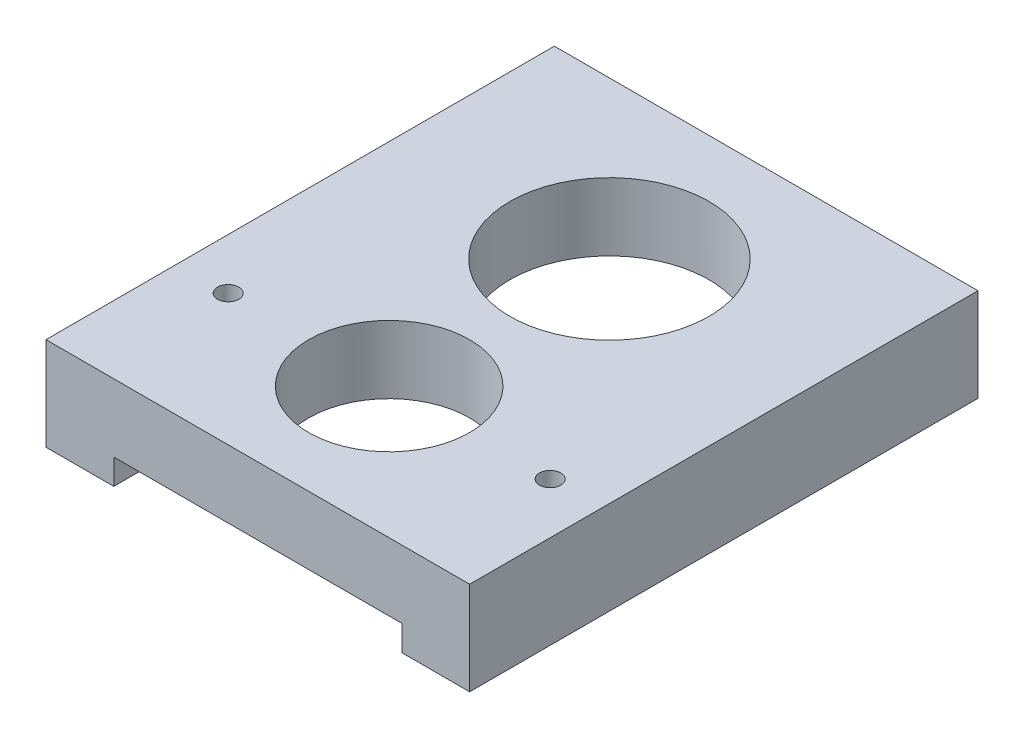
from build123d import *

# Parameters (mm, degrees)
EXTRUDE_1_DEPTH     = 60
SKETCH_2_R          = 11.75
CUT_EXTRUDE_1_DEPTH = 40
SKETCH_3_R          = 9.5
CUT_EXTRUDE_2_DEPTH = 40
M3X0_5_1_D          = 2.5
M3X0_5_1_DEPTH      = 5
M3X0_5_1_TIP        = 0.751075774


with BuildPart() as part:
    # 草圖1 → 填料-伸長1 (new body)
    with BuildSketch(Plane.XY):
        Polygon((-25, 0), (-17, 0), (-17, 3), (17, 3), (17, 0), (25, 0), (25, 11), (-25, 11), align=None)
    extrude(amount=EXTRUDE_1_DEPTH)

    # 草圖2 → 除料-伸長1 (cut)
    with BuildSketch(Plane(origin=(0, 11, 0), x_dir=(1, 0, 0), z_dir=(0, 1, 0))):
        with Locations((0, -18.5)):
            Circle(SKETCH_2_R)
    extrude(amount=-CUT_EXTRUDE_1_DEPTH, mode=Mode.SUBTRACT)

    # 草圖3 → 除料-伸長2 (cut)
    with BuildSketch(Plane(origin=(0, 11, 0), x_dir=(1, 0, 0), z_dir=(0, 1, 0))):
        with Locations((0, -44.5)):
            Circle(SKETCH_3_R)
    extrude(amount=-CUT_EXTRUDE_2_DEPTH, mode=Mode.SUBTRACT)

    # M3x0.5 螺紋孔1
    with Locations(Plane(origin=(0, 11, 0), x_dir=(1, 0, 0), z_dir=(0, 1, 0))):
        with Locations((19, -44.5), (-19, -44.5)):
            Hole(M3X0_5_1_D / 2, depth=M3X0_5_1_DEPTH)
            with Locations((0, 0, -(M3X0_5_1_DEPTH + M3X0_5_1_TIP / 2))):  # 118° drill point
                Cone(0, M3X0_5_1_D / 2, M3X0_5_1_TIP, mode=Mode.SUBTRACT)


solid = part.part
